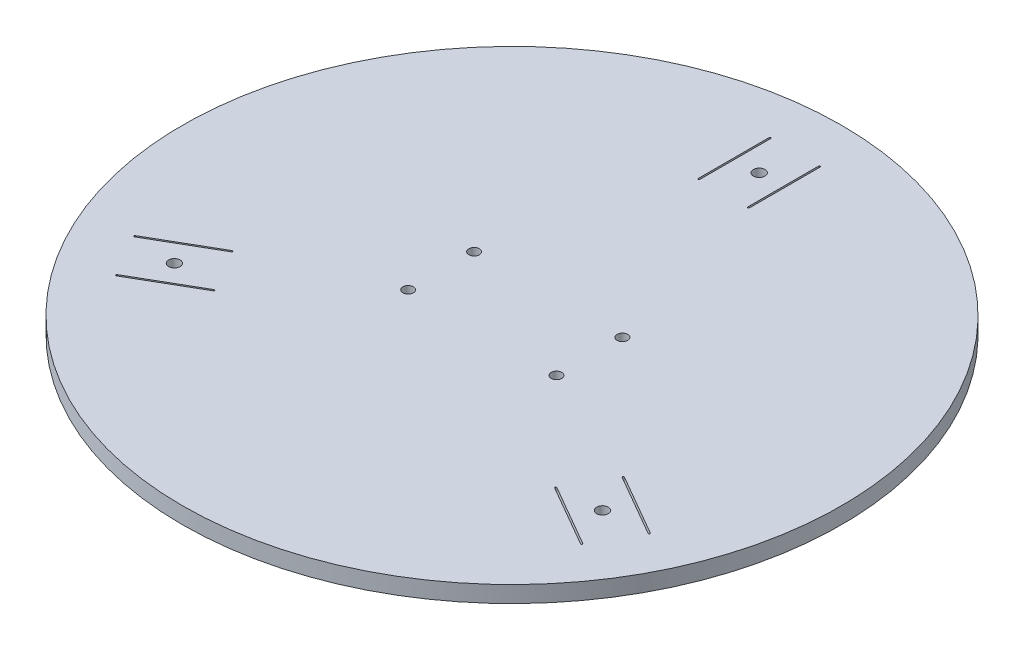
from build123d import *

# Parameters (mm, degrees)
SKETCH2_R                            = 100
BOSS_EXTRUDE1_DEPTH                  = 5
SKETCH3_R                            = 1.75
SKETCH3_W                            = 0.5
SKETCH3_H                            = 22
CUT_EXTRUDE1_DEPTH                   = 142.509716981
F_3_2_3_2_DIAMETER_HOLE1_D           = 3.2
F_3_2_3_2_DIAMETER_HOLE1_CSINK_D     = 3.25
F_3_2_3_2_DIAMETER_HOLE1_CSINK_ANGLE = 90
FILLET1_R                            = 0.2


with BuildPart() as part:
    # Sketch2 → Boss-Extrude1 (new body)
    with BuildSketch(Plane(origin=(0, 0, 0), x_dir=(1, 0, 0), z_dir=(0, 1, 0))):
        Circle(SKETCH2_R)
    extrude(amount=BOSS_EXTRUDE1_DEPTH)

    # Sketch3 → Cut-Extrude1 (cut, through all)
    with BuildSketch(Plane(origin=(0, 5, 0), x_dir=(1, 0, 0), z_dir=(0, 1, 0))):
        with Locations((0, 75)):
            Circle(SKETCH3_R)
        with Locations((64.951905284, -37.5)):
            Circle(SKETCH3_R)
        with Locations((-64.951905284, -37.5)):
            Circle(SKETCH3_R)
        with Locations((-7.5, 75)):
            Rectangle(SKETCH3_W, SKETCH3_H)
        with Locations((7.5, 75)):
            Rectangle(SKETCH3_W, SKETCH3_H)
        Polygon((59.300625842, -25.288303121), (78.353184725, -36.288303121), (78.103184725, -36.721315823), (59.050625842, -25.721315823), align=None)
        Polygon((51.800625842, -38.278684177), (70.853184725, -49.278684177), (70.603184725, -49.711696879), (51.550625842, -38.711696879), align=None)
        Polygon((-51.550625842, -38.711696879), (-70.603184725, -49.711696879), (-70.853184725, -49.278684177), (-51.800625842, -38.278684177), align=None)
        Polygon((-59.050625842, -25.721315823), (-78.103184725, -36.721315823), (-78.353184725, -36.288303121), (-59.300625842, -25.288303121), align=None)
    extrude(amount=-CUT_EXTRUDE1_DEPTH, mode=Mode.SUBTRACT)

    # Ø3.2 (3.2) Diameter Hole1 (through all)
    with Locations(Plane(origin=(0, 0, 0), x_dir=(-1, 0, 0), z_dir=(0, -1, 0))):
        with Locations((-22.5, 11), (22.5, 11), (22.5, -9), (-22.5, -9)):
            CounterSinkHole(F_3_2_3_2_DIAMETER_HOLE1_D / 2, F_3_2_3_2_DIAMETER_HOLE1_CSINK_D / 2, counter_sink_angle=F_3_2_3_2_DIAMETER_HOLE1_CSINK_ANGLE)

    # Fillet1
    fillet1_edges = [part.edges().sort_by_distance(p)[0] for p in [
        (59.050625842, 2.5, 25.721315823),
        (59.300625842, 2.5, 25.288303121),
        (78.353184725, 2.5, 36.288303121),
        (78.103184725, 2.5, 36.721315823),
        (-59.300625842, 2.5, 25.288303121),
        (-59.050625842, 2.5, 25.721315823),
        (-78.103184725, 2.5, 36.721315823),
        (-78.353184725, 2.5, 36.288303121),
        (-51.800625842, 2.5, 38.278684177),
        (-51.550625842, 2.5, 38.711696879),
        (-70.603184725, 2.5, 49.711696879),
        (-70.853184725, 2.5, 49.278684177),
        (51.550625842, 2.5, 38.711696879),
        (51.800625842, 2.5, 38.278684177),
        (70.853184725, 2.5, 49.278684177),
        (70.603184725, 2.5, 49.711696879),
        (7.25, 2.5, -64),
        (7.25, 2.5, -86),
        (7.75, 2.5, -86),
        (7.75, 2.5, -64),
        (-7.75, 2.5, -64),
        (-7.25, 2.5, -86),
        (-7.25, 2.5, -64),
        (-7.75, 2.5, -86),
    ]]
    fillet(fillet1_edges, radius=FILLET1_R)


solid = part.part
